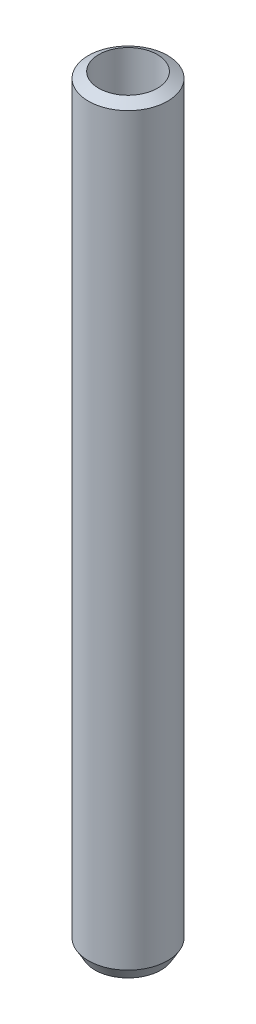
from build123d import *

# Parameters (mm, degrees)
SKETCH1_R           = 20
BOSS_EXTRUDE1_DEPTH = 384.846403
SKETCH2_R           = 14.774622499
CUT_EXTRUDE1_DEPTH  = 386.88437893
CHAMFER1_SIZE       = 3.344889
CHAMFER1_SIZE_2     = 5.793517


with BuildPart() as part:
    # Sketch1 → Boss-Extrude1 (new body)
    with BuildSketch(Plane(origin=(0, 0, 0), x_dir=(1, 0, 0), z_dir=(0, 1, 0))):
        with Locations(Location((0, 0, 0), (0, 0, 270))):
            Circle(SKETCH1_R)
    extrude(amount=BOSS_EXTRUDE1_DEPTH)

    # Sketch2 → Cut-Extrude1 (cut, through all)
    with BuildSketch(Plane(origin=(0, 0, 0), x_dir=(1, 0, 0), z_dir=(0, 1, 0))):
        with Locations(Location((0, 0, 0), (0, 0, 270))):
            Circle(SKETCH2_R)
    extrude(amount=CUT_EXTRUDE1_DEPTH, mode=Mode.SUBTRACT)

    # Chamfer1
    # the kernel refuses this chamfer: 5.793517, 3.344889 mm, written as the material it takes off along each edge
    with BuildSketch(Plane(origin=(0, 384.846403, 0), x_dir=(0, 0, 1), z_dir=(-1, 0, 0))) as chamfer1_piece_1:
        Polygon((20, -CHAMFER1_SIZE), (20 - CHAMFER1_SIZE_2, 0), (20, 0), align=None)
    revolve(axis=Axis((0, 384.846403, 0), (0, 1, 0)), mode=Mode.SUBTRACT)
    with BuildSketch(Plane(origin=(0, 0, 0), x_dir=(0, 0, 1), z_dir=(-1, 0, 0))) as chamfer1_piece_2:
        Polygon((20, CHAMFER1_SIZE_2), (20 - CHAMFER1_SIZE, 0), (20, 0), align=None)
    revolve(axis=Axis((0, 0, 0), (0, 1, 0)), mode=Mode.SUBTRACT)


solid = part.part
